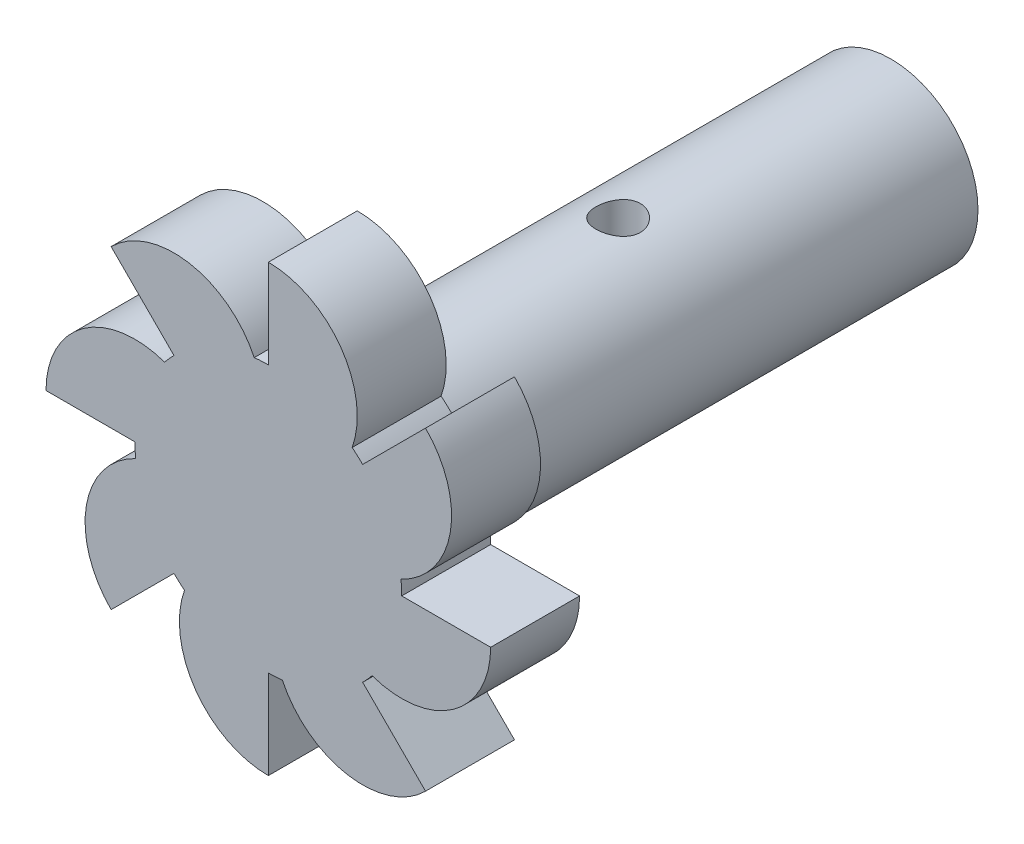
from build123d import *
from build123d.topology import SkipClean

# Parameters (mm, degrees)
SKETCH1_R           = 9.8
BOSS_EXTRUDE1_DEPTH = 60
BOSS_EXTRUDE3_DEPTH = 10
FILLET2_R           = 1
SKETCH3_R           = 6
CUT_EXTRUDE1_DEPTH  = 20
THREAD1_PITCH       = 1.75
SKETCH4_R           = 2.5
CUT_EXTRUDE2_DEPTH  = 15


with BuildPart() as part:
    # Sketch1 → Boss-Extrude1 (new body)
    with BuildSketch(Plane.XY):
        Circle(SKETCH1_R)
    extrude(amount=BOSS_EXTRUDE1_DEPTH)

    # Sketch2 → Boss-Extrude3 (add)
    with BuildSketch(Plane.XY.offset(60)):
        with BuildLine():
            Line((0, 25), (0, 15))
            ThreePointArc((0, 15), (-0.792563339, 14.979046811), (-1.582912447, 14.916245781))
            ThreePointArc((-1.582912447, 14.916245781), (-8.915581931, 20.462587314), (-17.67766953, 17.67766953))
            Line((-17.67766953, 17.67766953), (-10.606601718, 10.606601718))
            ThreePointArc((-10.606601718, 10.606601718), (-11.152212487, 10.031358664), (-11.666666667, 9.428090416))
            ThreePointArc((-11.666666667, 9.428090416), (-20.773502692, 8.164965809), (-25, 0))
            Line((-25, 0), (-15, 0))
            ThreePointArc((-15, 0), (-14.979046811, -0.792563339), (-14.916245781, -1.582912447))
            ThreePointArc((-14.916245781, -1.582912447), (-20.462587314, -8.915581931), (-17.67766953, -17.67766953))
            Line((-17.67766953, -17.67766953), (-10.606601718, -10.606601718))
            ThreePointArc((-10.606601718, -10.606601718), (-10.031358664, -11.152212487), (-9.428090416, -11.666666667))
            ThreePointArc((-9.428090416, -11.666666667), (-8.164965809, -20.773502692), (0, -25))
            Line((0, -25), (0, -15))
            ThreePointArc((0, -15), (0.792563339, -14.979046811), (1.582912447, -14.916245781))
            ThreePointArc((1.582912447, -14.916245781), (8.915581931, -20.462587314), (17.67766953, -17.67766953))
            Line((17.67766953, -17.67766953), (10.606601718, -10.606601718))
            ThreePointArc((10.606601718, -10.606601718), (11.152212487, -10.031358664), (11.666666667, -9.428090416))
            ThreePointArc((11.666666667, -9.428090416), (20.773502692, -8.164965809), (25, 0))
            Line((25, 0), (15, 0))
            ThreePointArc((15, 0), (14.979046811, 0.792563339), (14.916245781, 1.582912447))
            ThreePointArc((14.916245781, 1.582912447), (20.462587314, 8.915581931), (17.67766953, 17.67766953))
            Line((17.67766953, 17.67766953), (10.606601718, 10.606601718))
            ThreePointArc((10.606601718, 10.606601718), (10.031358664, 11.152212487), (9.428090416, 11.666666667))
            ThreePointArc((9.428090416, 11.666666667), (8.164965809, 20.773502692), (0, 25))
        make_face()
    extrude(amount=BOSS_EXTRUDE3_DEPTH)

    # Fillet2
    fillet2_edges = [part.edges().sort_by_distance(p)[0] for p in [
        (-9.8, 0, 60),
    ]]
    fillet(fillet2_edges, radius=FILLET2_R)

    # Sketch3 → Cut-Extrude1 (cut)
    with BuildSketch(Plane(origin=(0, 0, 0), x_dir=(-1, 0, 0), z_dir=(0, 0, -1))):
        Circle(SKETCH3_R)
    extrude(amount=-CUT_EXTRUDE1_DEPTH, mode=Mode.SUBTRACT)

    # Thread1: arcs per turn and ends read off the stored shape
    # Thread1: the profile of Thread Profile1 profile screwed along a left-hand helix through 11.428571 turns, 10 arcs to a turn; built about Z, then put on its axis
    with SkipClean():  # the faces are left unmerged after this step: merging them gives an invalid solid
        thread1_z = Axis((0, 0, 0), (0, 0, 1))
        thread1_corners = [(6.0003, 0, -0.000173205), (6.0003, 0, 1.5314232), (5.052784719, 0, 0.984374998), (5.052784719, 0, 0.546874998)]
        with BuildLine(mode=Mode.PRIVATE) as thread1_profile:
            Line(thread1_corners[0], thread1_corners[1])
            Line(thread1_corners[1], thread1_corners[2])
            Line(thread1_corners[2], thread1_corners[3])
            Line(thread1_corners[3], thread1_corners[0])
        thread1_cap = Face(thread1_profile.wire())
        thread1_turn_angles = [0, -18, -36, -54, -72, -90, -108, -126, -144, -162, -180, -198, -216, -234, -252, -270, -288, -306, -324, -342, -360]
        thread1_turn_weights = [1, 0.9510565162951535, 1, 0.9510565162951535, 1, 0.9510565162951535, 1, 0.9510565162951535, 1, 0.9510565162951535, 1, 0.9510565162951535, 1, 0.9510565162951535, 1, 0.9510565162951535, 1, 0.9510565162951535, 1, 0.9510565162951535, 1]
        thread1_turn_rails = [Edge.make_bspline([Vector(p[0], p[1], 0).rotate(thread1_z, thread1_turn_angles[k]) / thread1_turn_weights[k] + Vector(0, 0, p[2] + -THREAD1_PITCH * thread1_turn_angles[k] / 360) for k in range(21)], [0, 0, 0, 1, 1, 2, 2, 3, 3, 4, 4, 5, 5, 6, 6, 7, 7, 8, 8, 9, 9, 10, 10, 10], 2, thread1_turn_weights) for p in thread1_corners]
        thread1_turn_sides = [Face.make_surface_from_curves(thread1_turn_rails[p[0]], thread1_turn_rails[p[1]]) for p in [(0, 1), (1, 2), (2, 3), (3, 0)]]
        thread1_last_angles = [-3960, -3978, -3996, -4014, -4032, -4050, -4068, -4086, -4104, -4109.142857143, -4114.285714286]
        thread1_last_weights = [1, 0.9510565162951535, 1, 0.9510565162951535, 1, 0.9510565162951535, 1, 0.9510565162951535, 1, 0.995974293995238, 1]
        thread1_last_rails = [Edge.make_bspline([Vector(p[0], p[1], 0).rotate(thread1_z, thread1_last_angles[k]) / thread1_last_weights[k] + Vector(0, 0, p[2] + -THREAD1_PITCH * thread1_last_angles[k] / 360) for k in range(11)], [0, 0, 0, 1, 1, 2, 2, 3, 3, 4, 4, 5, 5, 5], 2, thread1_last_weights) for p in thread1_corners]
        thread1_last_sides = [Face.make_surface_from_curves(thread1_last_rails[p[0]], thread1_last_rails[p[1]]) for p in [(0, 1), (1, 2), (2, 3), (3, 0)]]
        thread1 = Plane(origin=(0, 0, 0), x_dir=(1, 0, 0), z_dir=(0, 0, 1)) * Solid(Shell([*[p.moved(Location((0, 0, THREAD1_PITCH * i))) for i in range(11) for p in thread1_turn_sides], *thread1_last_sides, thread1_cap, thread1_cap.rotate(thread1_z, -4114.285714286).moved(Location((0, 0, -THREAD1_PITCH * -4114.285714286 / 360)))]))
        add(thread1)

    # Sketch4 → Cut-Extrude2 (cut, symmetric)
    with SkipClean():  # the faces are left unmerged after this step: merging them gives an invalid solid
        with BuildSketch(Plane(origin=(0, 0, 0), x_dir=(1, 0, 0), z_dir=(0, 1, 0))):
            with Locations(Location((0, -30.667881515, 0), (0, 0, 270))):
                Circle(SKETCH4_R)
        extrude(amount=CUT_EXTRUDE2_DEPTH, both=True, mode=Mode.SUBTRACT)


solid = part.part
